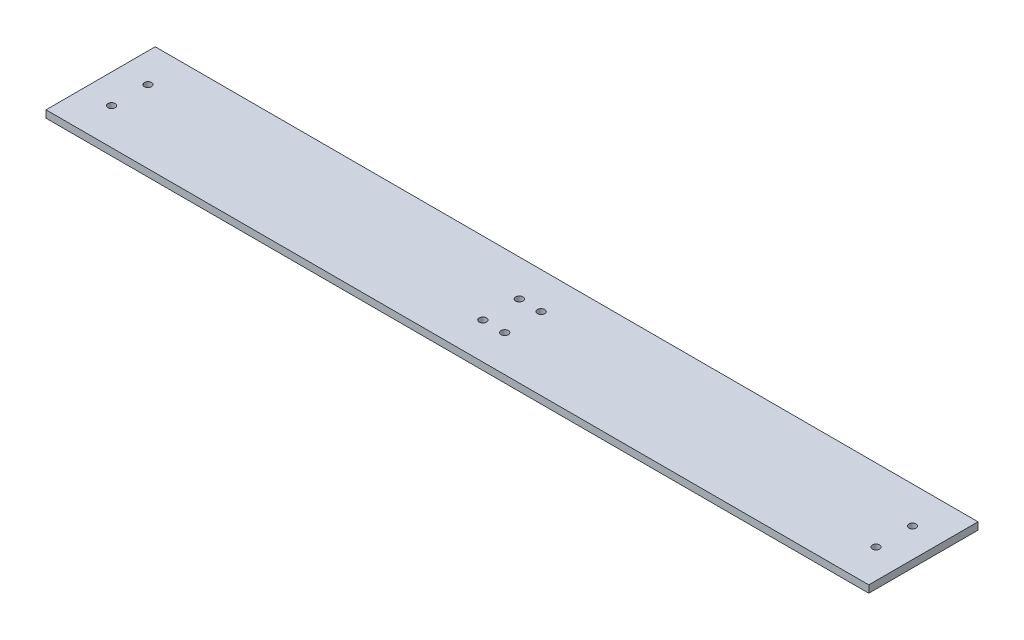
from build123d import *

# Parameters (mm, degrees)
SKETCH_1_W          = 150
SKETCH_1_H          = 10
EXTRUDE_1_DEPTH     = 1130
SKETCH_2_R          = 5
CUT_EXTRUDE_1_DEPTH = 1140.956139507


with BuildPart() as part:
    # Эскиз1 → Бобышка-Вытянуть1 (new body)
    with BuildSketch(Plane(origin=(0, 0, 0), x_dir=(0, 0, -1), z_dir=(1, 0, 0))):
        with Locations((75, 5)):
            Rectangle(SKETCH_1_W, SKETCH_1_H)
    extrude(amount=EXTRUDE_1_DEPTH)

    # Эскиз2 → Вырез-Вытянуть1 (cut, through all)
    with BuildSketch(Plane(origin=(0, 10, 0), x_dir=(1, 0, 0), z_dir=(0, 1, 0))):
        with Locations((40, 50)):
            Circle(SKETCH_2_R)
        with Locations((550, 50)):
            Circle(SKETCH_2_R)
        with Locations((550, 100)):
            Circle(SKETCH_2_R)
        with Locations((40, 100)):
            Circle(SKETCH_2_R)
        with Locations((1090, 100)):
            Circle(SKETCH_2_R)
        with Locations((580, 100)):
            Circle(SKETCH_2_R)
        with Locations((580, 50)):
            Circle(SKETCH_2_R)
        with Locations((1090, 50)):
            Circle(SKETCH_2_R)
    extrude(amount=-CUT_EXTRUDE_1_DEPTH, mode=Mode.SUBTRACT)


solid = part.part
